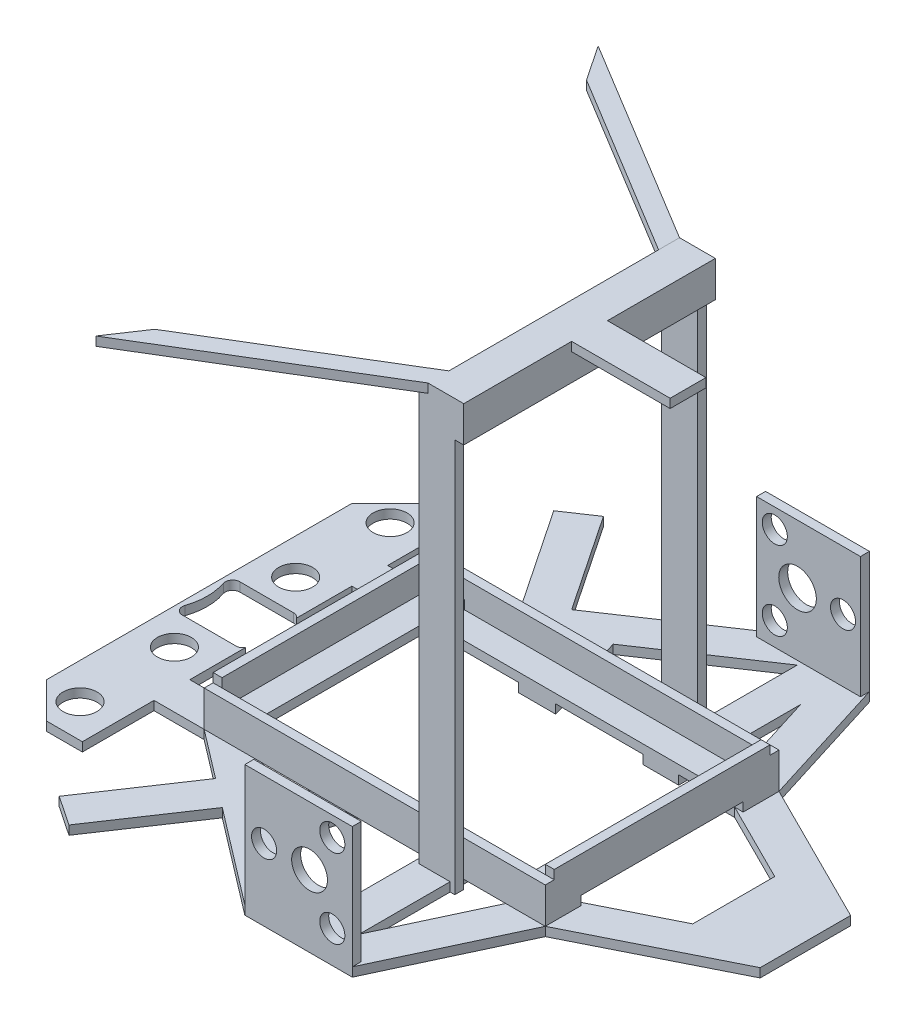
from build123d import *

# Parameters (mm, degrees)
BATTERY_FRONT_SKETCH_W        = 5
BATTERY_FRONT_SKETCH_H        = 15
BATTERY_FRONT_SKETCH_H_2      = 5
BATTERY_FRONT_SKETCH_W_2      = 15
BATTERY_FRONT_DEPTH           = 120.5
BATTERY_REAR_SKETCH_W         = 5
BATTERY_REAR_SKETCH_H         = 15
BATTERY_REAR_SKETCH_H_2       = 5
BATTERY_REAR_SKETCH_W_2       = 15
BATTERY_REAR_DEPTH            = 120.5
BATTERY_SIDE_REACH            = 227.91
BATTERY_SIDE_SKETCH_W         = 5
BATTERY_SIDE_SKETCH_H         = 15
BATTERY_SIDE_SKETCH_H_2       = 5
BATTERY_SIDE_SKETCH_W_2       = 15
LEFT_MOTOR_ATTACH_SKETCH_W    = 58
LEFT_MOTOR_ATTACH_SKETCH_H    = 67.852479089
LEFT_MOTOR_ATTACH_SKETCH_R    = 7
LEFT_MOTOR_ATTACH_SKETCH_R_2  = 10.5
LEFT_MOTOR_ATTACH_DEPTH       = 5
RIGHT_MOTOR_ATTACH_SKETCH_W   = 60
RIGHT_MOTOR_ATTACH_SKETCH_H   = 67.852479089
RIGHT_MOTOR_ATTACH_SKETCH_R   = 7
RIGHT_MOTOR_ATTACH_SKETCH_R_2 = 10
RIGHT_MOTOR_ATTACH_DEPTH      = 5
SUPPORT_DEPTH                 = 5
SUPPORT_TO_MOTOR_1_DEPTH      = 5
SUPPORT_TO_MOTOR_SKETCH_2_W   = 20
SUPPORT_TO_MOTOR_SKETCH_2_H   = 93.5
SUPPORT_TO_MOTOR_2_DEPTH      = 5
SIDE_SUPPORT_DEPTH            = 5
SENSOR_ARRAY_OUTLINE_R        = 9.5
SENSOR_ARRAY_DEPTH            = 5
VERTICAL_SUPPORT_SKETCH_W     = 20
VERTICAL_SUPPORT_SKETCH_H     = 235
VERTICAL_SUPPORT_DEPTH        = 5
HORIZONTAL_SUPPORT_REACH      = 346.574
HORIZONTAL_SUPPORT_SKETCH_W   = 15
HORIZONTAL_SUPPORT_SKETCH_H   = 5
HORIZONTAL_SUPPORT_SKETCH_W_2 = 5
HORIZONTAL_SUPPORT_SKETCH_H_2 = 15
SUPPORT_FOR_BARS_SKETCH1_W    = 75
SUPPORT_FOR_BARS_SKETCH1_H    = 20
SUPPORT_FOR_BARS1_DEPTH       = 5
SUPPORT_FOR_BARS2_DEPTH       = 5
SUPPORT_FOR_BARS4_DEPTH       = 5
ARRAY_CHAMFER1_SIZE           = 20
ARRAY_CHAMPER2_SIZE           = 20
FRONT_CASTER_SUPPORT_DEPTH    = 5


# Read off the part's stored shape, not the designer's step: Sensor Array
with BuildPart() as part:
    # Battery Front sketch → Battery Front (new body)
    with BuildSketch(Plane.XY):
        with Locations((92.75, 7.5)):
            Rectangle(BATTERY_FRONT_SKETCH_W, BATTERY_FRONT_SKETCH_H)
        with Locations((92.75, -2.5)):
            Rectangle(BATTERY_FRONT_SKETCH_W, BATTERY_FRONT_SKETCH_H_2)
        with Locations((82.75, -2.5)):
            Rectangle(BATTERY_FRONT_SKETCH_W_2, BATTERY_FRONT_SKETCH_H_2)
    extrude(amount=-BATTERY_FRONT_DEPTH)

    # Battery Side: up to this face of the body (flat: up to its plane)
    battery_side_end = Plane(part.part.faces().sort_by_distance((95.25, 5, -60.25))[0])
    # Battery Side Sketch → Battery Side (add, up to the picked face)
    with BuildSketch(Plane.ZY.offset(95.25), mode=Mode.PRIVATE) as battery_side_sk1:
        with Locations((2.5, 2.5)):
            Rectangle(BATTERY_SIDE_SKETCH_W, BATTERY_SIDE_SKETCH_H)
    battery_side_tool1 = split(extrude(battery_side_sk1.sketch, amount=-BATTERY_SIDE_REACH, mode=Mode.PRIVATE), bisect_by=battery_side_end, keep=Keep.BOTH, mode=Mode.PRIVATE)
    # Battery Side Sketch → Battery Side (add, up to the picked face)
    with BuildSketch(Plane.ZY.offset(95.25), mode=Mode.PRIVATE) as battery_side_sk2:
        with Locations((2.5, -7.5)):
            Rectangle(BATTERY_SIDE_SKETCH_W, BATTERY_SIDE_SKETCH_H_2)
    battery_side_tool2 = split(extrude(battery_side_sk2.sketch, amount=-BATTERY_SIDE_REACH, mode=Mode.PRIVATE), bisect_by=battery_side_end, keep=Keep.BOTH, mode=Mode.PRIVATE)
    # Battery Side Sketch → Battery Side (add, up to the picked face)
    with BuildSketch(Plane.ZY.offset(95.25), mode=Mode.PRIVATE) as battery_side_sk3:
        with Locations((-7.5, -7.5)):
            Rectangle(BATTERY_SIDE_SKETCH_W_2, BATTERY_SIDE_SKETCH_H_2)
    battery_side_tool3 = split(extrude(battery_side_sk3.sketch, amount=-BATTERY_SIDE_REACH, mode=Mode.PRIVATE), bisect_by=battery_side_end, keep=Keep.BOTH, mode=Mode.PRIVATE)
    # Battery Side Sketch → Battery Side (add, up to the picked face)
    with BuildSketch(Plane.ZY.offset(95.25), mode=Mode.PRIVATE) as battery_side_sk4:
        with Locations((-123, 2.5)):
            Rectangle(BATTERY_SIDE_SKETCH_W, BATTERY_SIDE_SKETCH_H)
    battery_side_tool4 = split(extrude(battery_side_sk4.sketch, amount=-BATTERY_SIDE_REACH, mode=Mode.PRIVATE), bisect_by=battery_side_end, keep=Keep.BOTH, mode=Mode.PRIVATE)
    # Battery Side Sketch → Battery Side (add, up to the picked face)
    with BuildSketch(Plane.ZY.offset(95.25), mode=Mode.PRIVATE) as battery_side_sk5:
        with Locations((-113, -7.5)):
            Rectangle(BATTERY_SIDE_SKETCH_W_2, BATTERY_SIDE_SKETCH_H_2)
    battery_side_tool5 = split(extrude(battery_side_sk5.sketch, amount=-BATTERY_SIDE_REACH, mode=Mode.PRIVATE), bisect_by=battery_side_end, keep=Keep.BOTH, mode=Mode.PRIVATE)
    # Battery Side Sketch → Battery Side (add, up to the picked face)
    with BuildSketch(Plane.ZY.offset(95.25), mode=Mode.PRIVATE) as battery_side_sk6:
        with Locations((-123, -7.5)):
            Rectangle(BATTERY_SIDE_SKETCH_W, BATTERY_SIDE_SKETCH_H_2)
    battery_side_tool6 = split(extrude(battery_side_sk6.sketch, amount=-BATTERY_SIDE_REACH, mode=Mode.PRIVATE), bisect_by=battery_side_end, keep=Keep.BOTH, mode=Mode.PRIVATE)


with BuildPart() as body_2:
    # Battery Rear Sketch → Battery Rear (new body)
    with BuildSketch(Plane(origin=(0, 0, -120.5), x_dir=(-1, 0, 0), z_dir=(0, 0, -1))):
        with Locations((92.75, 7.5)):
            Rectangle(BATTERY_REAR_SKETCH_W, BATTERY_REAR_SKETCH_H)
        with Locations((92.75, -2.5)):
            Rectangle(BATTERY_REAR_SKETCH_W, BATTERY_REAR_SKETCH_H_2)
        with Locations((82.75, -2.5)):
            Rectangle(BATTERY_REAR_SKETCH_W_2, BATTERY_REAR_SKETCH_H_2)
    extrude(amount=-BATTERY_REAR_DEPTH)


with BuildPart() as part_1:
    add(part.part)

    add(body_2.part)  # Battery Side merges body 2
    add(battery_side_tool1.solids().sort_by(Axis((-95.25, 2.5, 2.5), (1, 0, 0)))[0])
    add(battery_side_tool2.solids().sort_by(Axis((-95.25, -7.5, 2.5), (1, 0, 0)))[0])
    add(battery_side_tool3.solids().sort_by(Axis((-95.25, -7.5, -7.5), (1, 0, 0)))[0])
    add(battery_side_tool4.solids().sort_by(Axis((-95.25, 2.5, -123), (1, 0, 0)))[0])
    add(battery_side_tool5.solids().sort_by(Axis((-95.25, -7.5, -113), (1, 0, 0)))[0])
    add(battery_side_tool6.solids().sort_by(Axis((-95.25, -7.5, -123), (1, 0, 0)))[0])



with BuildPart() as body_2_2:
    # Left Motor Attach Sketch → Left Motor Attach (new body)
    with BuildSketch(Plane(origin=(0, 0, -194), x_dir=(-1, 0, 0), z_dir=(0, 0, -1))):
        with Locations((-43.267865949, 23.926239545)):
            Rectangle(LEFT_MOTOR_ATTACH_SKETCH_W, LEFT_MOTOR_ATTACH_SKETCH_H)
        with Locations((-24.417865949, 46.999524345)):
            Circle(LEFT_MOTOR_ATTACH_SKETCH_R, mode=Mode.SUBTRACT)
        with Locations((-62.517865949, 25.002479089)):
            Circle(LEFT_MOTOR_ATTACH_SKETCH_R, mode=Mode.SUBTRACT)
        with Locations((-24.417865949, 3.005433833)):
            Circle(LEFT_MOTOR_ATTACH_SKETCH_R, mode=Mode.SUBTRACT)
        with Locations((-37.117865949, 25.002479089)):
            Circle(LEFT_MOTOR_ATTACH_SKETCH_R_2, mode=Mode.SUBTRACT)
    extrude(amount=LEFT_MOTOR_ATTACH_DEPTH)


with BuildPart() as body_3:
    # Right Motor Attach Sketch → Right Motor Attach (new body)
    with BuildSketch(Plane.XY.offset(73.5)):
        with Locations((30.967865949, 23.926239545)):
            Rectangle(RIGHT_MOTOR_ATTACH_SKETCH_W, RIGHT_MOTOR_ATTACH_SKETCH_H)
        with Locations((49.817865949, 46.999524345)):
            Circle(RIGHT_MOTOR_ATTACH_SKETCH_R, mode=Mode.SUBTRACT)
        with Locations((49.817865949, 3.005433833)):
            Circle(RIGHT_MOTOR_ATTACH_SKETCH_R, mode=Mode.SUBTRACT)
        with Locations((11.717865949, 25.002479089)):
            Circle(RIGHT_MOTOR_ATTACH_SKETCH_R, mode=Mode.SUBTRACT)
        with Locations((37.117865949, 25.002479089)):
            Circle(RIGHT_MOTOR_ATTACH_SKETCH_R_2, mode=Mode.SUBTRACT)
    extrude(amount=RIGHT_MOTOR_ATTACH_DEPTH)


with BuildPart() as part_2:
    add(part_1.part)

    add(body_2_2.part)  # Support merges body 2 2
    # Support Sketch → Support (add)
    with BuildSketch(Plane(origin=(0, -10, 0), x_dir=(-1, 0, 0), z_dir=(0, -1, 0))):
        Polygon((-14.267865949, 199), (95.25, 125.5), (95.25, 105.5), (89.160858149, 105.5), (-50.157787649, 199), align=None)
        Polygon((95.25, -5), (-0.967865949, -78.5), (-33.914536533, -78.5), (88.485061646, 15), (95.25, 15), align=None)
    extrude(amount=SUPPORT_DEPTH)


    add(body_3.part)  # Support to motor 1 merges body 3
    # Support to motor sketch 1 → Support to motor 1 (add)
    with BuildSketch(Plane(origin=(0, -10, 0), x_dir=(-1, 0, 0), z_dir=(0, -1, 0))):
        Polygon((-60.967865949, -78.5), (-95.25, -5), (-95.25, 15), (-82.509933452, 15), (-38.89932755, -78.5), align=None)
        Polygon((-95.25, 125.5), (-72.267865949, 199), (-51.312961099, 199), (-80.548737069, 105.5), (-95.25, 105.5), align=None)
    extrude(amount=SUPPORT_TO_MOTOR_1_DEPTH)

    # Support to motor sketch 2 → Support to motor 2 (add)
    with BuildSketch(Plane(origin=(0, -10, 0), x_dir=(-1, 0, 0), z_dir=(0, -1, 0))):
        with Locations((-37.117865949, -31.75)):
            Rectangle(SUPPORT_TO_MOTOR_SKETCH_2_W, SUPPORT_TO_MOTOR_SKETCH_2_H)
        with Locations((-49.267865949, 152.25)):
            Rectangle(SUPPORT_TO_MOTOR_SKETCH_2_W, SUPPORT_TO_MOTOR_SKETCH_2_H)
    extrude(amount=SUPPORT_TO_MOTOR_2_DEPTH)

    # Side Support sketch → Side Support (add)
    with BuildSketch(Plane(origin=(0, -10, 0), x_dir=(-1, 0, 0), z_dir=(0, -1, 0))):
        Polygon((30.622642515, -54.368282369), (9.328927137, 15), (30.25, 15), (47.569797237, -41.42249668), align=None)
        Polygon((9.458670401, 105.5), (27.967517526, 170.654846828), (45.42969652, 158.935570298), (30.25, 105.5), align=None)
    extrude(amount=SIDE_SUPPORT_DEPTH)

    # Sensor Array outline → Sensor Array (add)
    with BuildSketch(Plane(origin=(0, -14.978153268, 0), x_dir=(1, 0, 0), z_dir=(0, 1, 0))):
        with BuildLine():
            Line((-95.25, 15), (-123.25, 15))
            Line((-123.25, 15), (-123.25, 46.00829027))
            ThreePointArc((-123.25, 46.00829027), (-124.72781547, 44.662278734), (-126.666434838, 44.175))
            Line((-126.666434838, 44.175), (-156.616434838, 44.175))
            ThreePointArc((-156.616434838, 44.175), (-159.943838941, 45.879507998), (-160.504615286, 49.5757893))
            ThreePointArc((-160.504615286, 49.5757893), (-158.766434838, 60.25), (-160.504615286, 70.9242107))
            ThreePointArc((-160.504615286, 70.9242107), (-159.943838941, 74.620492002), (-156.616434838, 76.325))
            Line((-156.616434838, 76.325), (-126.666434838, 76.325))
            ThreePointArc((-126.666434838, 76.325), (-124.72781547, 75.837721266), (-123.25, 74.49170973))
            Line((-123.25, 74.49170973), (-123.25, 105.5))
            Line((-123.25, 105.5), (-95.25, 105.5))
            Line((-95.25, 105.5), (-95.25, 125.5))
            Line((-95.25, 125.5), (-123.25, 125.5))
            Line((-123.25, 125.5), (-123.25, 165.5))
            Line((-123.25, 165.5), (-163.25, 165.5))
            Line((-163.25, 165.5), (-163.25, -45))
            Line((-163.25, -45), (-123.25, -45))
            Line((-123.25, -45), (-123.25, -5))
            Line((-123.25, -5), (-95.25, -5))
            Line((-95.25, -5), (-95.25, 15))
        make_face()
        with Locations((-143.25, -26.319219382)):
            Circle(SENSOR_ARRAY_OUTLINE_R, mode=Mode.SUBTRACT)
        with Locations((-143.25, 26.393593539)):
            Circle(SENSOR_ARRAY_OUTLINE_R, mode=Mode.SUBTRACT)
        with Locations((-143.25, 94.106406461)):
            Circle(SENSOR_ARRAY_OUTLINE_R, mode=Mode.SUBTRACT)
        with Locations((-143.25, 146.819219382)):
            Circle(SENSOR_ARRAY_OUTLINE_R, mode=Mode.SUBTRACT)
    extrude(amount=SENSOR_ARRAY_DEPTH)

    # Vertical Support sketch → Vertical Support (add)
    with BuildSketch(Plane(origin=(0, 0, -125.5), x_dir=(-1, 0, 0), z_dir=(0, 0, -1))):
        with Locations((-39.71735315, 102.5)):
            Rectangle(VERTICAL_SUPPORT_SKETCH_W, VERTICAL_SUPPORT_SKETCH_H)
    vertical_support = extrude(amount=VERTICAL_SUPPORT_DEPTH)

    # Other Vertical Support: Vertical Support across plane
    add(vertical_support.mirror(Plane(origin=(-85.306480521, -17.600587879, -60.25), x_dir=(1, 0, 0), z_dir=(0, 0, -1))))

    # Horizontal Support: up to this face of the body (flat: up to its plane)
    horizontal_support_end = Plane(part_2.part.faces().sort_by_distance((39.741866718, 104.668935708, 10))[0])
    # Horizontal Support Sketch → Horizontal Support (add, up to the picked face)
    with BuildSketch(Plane(origin=(0, 0, -130.5), x_dir=(-1, 0, 0), z_dir=(0, 0, -1)), mode=Mode.PRIVATE) as horizontal_support_sk1:
        with Locations((-42.21735315, 222.5)):
            Rectangle(HORIZONTAL_SUPPORT_SKETCH_W, HORIZONTAL_SUPPORT_SKETCH_H)
    horizontal_support_tool1 = split(extrude(horizontal_support_sk1.sketch, amount=-HORIZONTAL_SUPPORT_REACH, mode=Mode.PRIVATE), bisect_by=horizontal_support_end, keep=Keep.BOTH, mode=Mode.PRIVATE)
    # Horizontal Support Sketch → Horizontal Support (add, up to the picked face)
    with BuildSketch(Plane(origin=(0, 0, -130.5), x_dir=(-1, 0, 0), z_dir=(0, 0, -1)), mode=Mode.PRIVATE) as horizontal_support_sk2:
        with Locations((-52.21735315, 222.5)):
            Rectangle(HORIZONTAL_SUPPORT_SKETCH_W_2, HORIZONTAL_SUPPORT_SKETCH_H)
    horizontal_support_tool2 = split(extrude(horizontal_support_sk2.sketch, amount=-HORIZONTAL_SUPPORT_REACH, mode=Mode.PRIVATE), bisect_by=horizontal_support_end, keep=Keep.BOTH, mode=Mode.PRIVATE)
    # Horizontal Support Sketch → Horizontal Support (add, up to the picked face)
    with BuildSketch(Plane(origin=(0, 0, -130.5), x_dir=(-1, 0, 0), z_dir=(0, 0, -1)), mode=Mode.PRIVATE) as horizontal_support_sk3:
        with Locations((-52.21735315, 212.5)):
            Rectangle(HORIZONTAL_SUPPORT_SKETCH_W_2, HORIZONTAL_SUPPORT_SKETCH_H_2)
    horizontal_support_tool3 = split(extrude(horizontal_support_sk3.sketch, amount=-HORIZONTAL_SUPPORT_REACH, mode=Mode.PRIVATE), bisect_by=horizontal_support_end, keep=Keep.BOTH, mode=Mode.PRIVATE)
    add(horizontal_support_tool1.solids().sort_by(Axis((42.217353, 222.5, -130.5), (0, 0, 1)))[0])
    add(horizontal_support_tool2.solids().sort_by(Axis((52.217353, 222.5, -130.5), (0, 0, 1)))[0])
    add(horizontal_support_tool3.solids().sort_by(Axis((52.217353, 212.5, -130.5), (0, 0, 1)))[0])

    # Support for bars sketch1 → Support for bars1 (add)
    with BuildSketch(Plane(origin=(0, 225, 0), x_dir=(1, 0, 0), z_dir=(0, 1, 0))):
        with Locations((72.21735315, 60.25)):
            Rectangle(SUPPORT_FOR_BARS_SKETCH1_W, SUPPORT_FOR_BARS_SKETCH1_H)
    extrude(amount=-SUPPORT_FOR_BARS1_DEPTH)

    # Support for bars sketch2 → Support for bars2 (add)
    with BuildSketch(Plane(origin=(0, -10, 0), x_dir=(1, 0, 0), z_dir=(0, 1, 0))):
        Polygon((-39.389302981, 138.902854166), (-86.756360903, 209.48161743), (-103.36312873, 198.336427331), (-55.996070808, 127.757664067), align=None)
    support_for_bars2 = extrude(amount=-SUPPORT_FOR_BARS2_DEPTH)

    # Support for bars3: Support for bars2 across plane
    add(support_for_bars2.mirror(Plane(origin=(-85.306480521, -17.600587879, -60.25), x_dir=(1, 0, 0), z_dir=(0, 0, -1))))


with BuildPart() as body_2_3:
    # Support for bars sketch4 → Support for bars4 (new body)
    with BuildSketch(Plane(origin=(0, 225, 0), x_dir=(1, 0, 0), z_dir=(0, 1, 0))):
        Polygon((34.71735315, 130.5), (-80.722295441, 200.490624609), (-67.510082338, 180.785687221), (34.71735315, 118.805577707), align=None)
    support_for_bars4 = extrude(amount=-SUPPORT_FOR_BARS4_DEPTH)


with BuildPart() as part_3:
    add(part_2.part)

    # Support for bars sketch5: Support for bars4 across plane
    add(support_for_bars4.mirror(Plane(origin=(-85.306480521, -17.600587879, -60.25), x_dir=(1, 0, 0), z_dir=(0, 0, -1))))

    # Array chamfer1
    array_chamfer1_edges = [part_3.edges().sort_by_distance(p)[0] for p in [
        (-163.25, -12.478153268, -165.5),
    ]]
    chamfer(array_chamfer1_edges, length=ARRAY_CHAMFER1_SIZE)

    # Array champer2
    array_champer2_edges = [part_3.edges().sort_by_distance(p)[0] for p in [
        (-163.25, -12.478153268, 45),
    ]]
    chamfer(array_champer2_edges, length=ARRAY_CHAMPER2_SIZE)

    # Front Caster support sketch → Front Caster support (add)
    with BuildSketch(Plane.XZ.offset(15)):
        Polygon((95.25, 5), (175.25, -35), (175.25, -85.5), (95.25, -125.5), (95.25, -105.5), (90.52864045, -105.5), (135.25, -83.139320225), (135.25, -37.360679775), (90.52864045, -15), (95.25, -15), align=None)
    extrude(amount=-FRONT_CASTER_SUPPORT_DEPTH)


solid = Compound([body_2_3.part, part_3.part])
